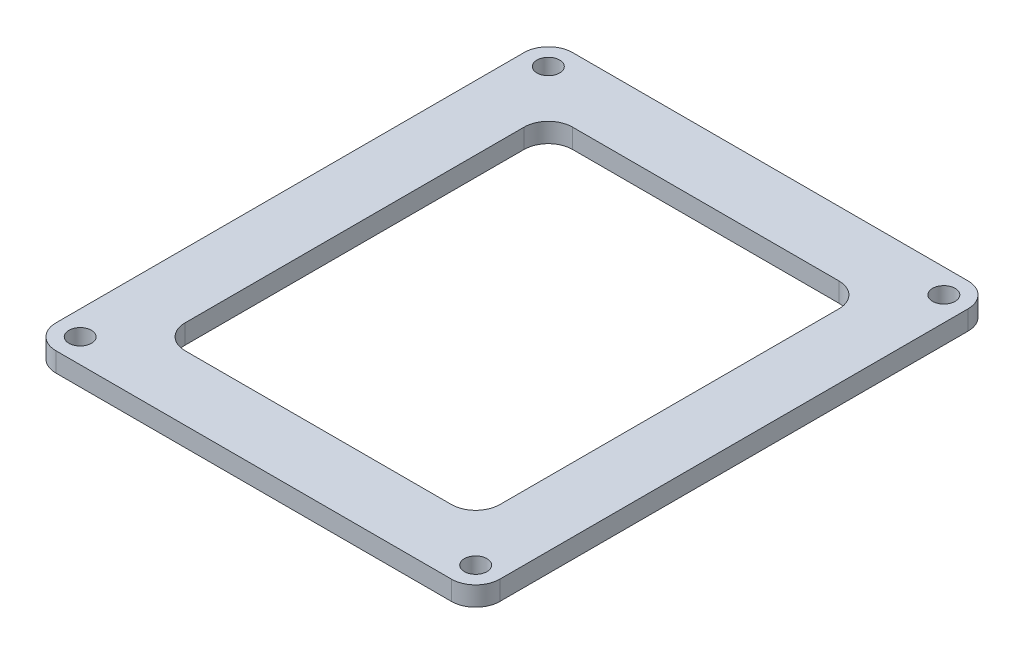
from build123d import *

# Parameters (mm, degrees)
SKETCH_1_W      = 55
SKETCH_1_H      = 64
SKETCH_1_R      = 1.4
SKETCH_1_W_2    = 39
SKETCH_1_H_2    = 48
EXTRUDE_1_DEPTH = 2.4
FILLET_1_R      = 3


with BuildPart() as part:
    # 草图1 → 凸台-拉伸1 (new body)
    with BuildSketch(Plane(origin=(0, 0, 0), x_dir=(1, 0, 0), z_dir=(0, 1, 0))):
        Rectangle(SKETCH_1_W, SKETCH_1_H)
        with Locations((-24.5, 29)):
            Circle(SKETCH_1_R, mode=Mode.SUBTRACT)
        with Locations((24.5, 29)):
            Circle(SKETCH_1_R, mode=Mode.SUBTRACT)
        with Locations((24.5, -29)):
            Circle(SKETCH_1_R, mode=Mode.SUBTRACT)
        with Locations((-24.5, -29)):
            Circle(SKETCH_1_R, mode=Mode.SUBTRACT)
        Rectangle(SKETCH_1_W_2, SKETCH_1_H_2, mode=Mode.SUBTRACT)
    extrude(amount=EXTRUDE_1_DEPTH)

    # 圆角1
    fillet_1_edges = [part.edges().sort_by_distance(p)[0] for p in [
        (-27.5, 1.2, -32),
        (27.5, 1.2, -32),
        (27.5, 1.2, 32),
        (-27.5, 1.2, 32),
        (-19.5, 1.2, 24),
        (19.5, 1.2, 24),
        (19.5, 1.2, -24),
        (-19.5, 1.2, -24),
    ]]
    fillet(fillet_1_edges, radius=FILLET_1_R)


solid = part.part
